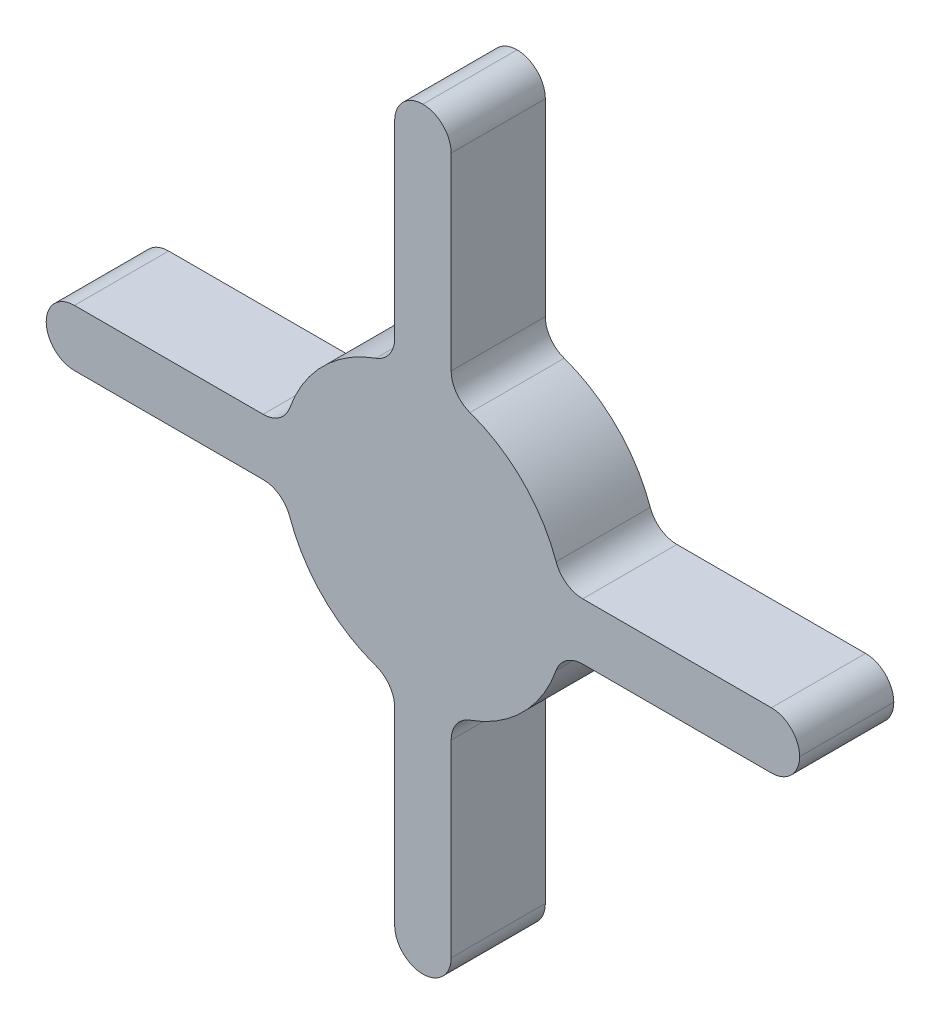
from build123d import *

# Parameters (mm, degrees)
BOSS_EXTRUDE1_DEPTH = 6.35
SKETCH2_R           = 9.525
BOSS_EXTRUDE2_DEPTH = 6.35
FILLET1_R           = 1.905


with BuildPart() as part:
    # Sketch1 → Boss-Extrude1 (new body)
    with BuildSketch(Plane.XY):
        Polygon((0, 25.4), (1.905, 25.4), (1.905, 1.905), (25.4, 1.905), (25.4, 0), (25.4, -1.905), (1.905, -1.905), (1.905, -25.4), (0, -25.4), (-1.905, -25.4), (-1.905, -1.905), (-25.4, -1.905), (-25.4, 0), (-25.4, 1.905), (-1.905, 1.905), (-1.905, 25.4), align=None)
    extrude(amount=BOSS_EXTRUDE1_DEPTH)

    # Sketch2 → Boss-Extrude2 (add)
    with BuildSketch(Plane.XY):
        Circle(SKETCH2_R)
    extrude(amount=BOSS_EXTRUDE2_DEPTH)

    # Fillet1
    fillet1_edges = [part.edges().sort_by_distance(p)[0] for p in [
        (-9.33255592, -1.905, 3.175),
        (-1.905, -9.33255592, 3.175),
        (-9.33255592, 1.905, 3.175),
        (-1.905, 9.33255592, 3.175),
        (1.905, 9.33255592, 3.175),
        (9.33255592, 1.905, 3.175),
        (9.33255592, -1.905, 3.175),
        (1.905, -9.33255592, 3.175),
        (25.4, 1.905, 3.175),
        (25.4, -1.905, 3.175),
        (1.905, -25.4, 3.175),
        (-1.905, -25.4, 3.175),
        (-25.4, -1.905, 3.175),
        (-25.4, 1.905, 3.175),
        (-1.905, 25.4, 3.175),
        (1.905, 25.4, 3.175),
    ]]
    fillet(fillet1_edges, radius=FILLET1_R - 0.0001)  # a hair under: the kernel refuses the full size


solid = part.part
